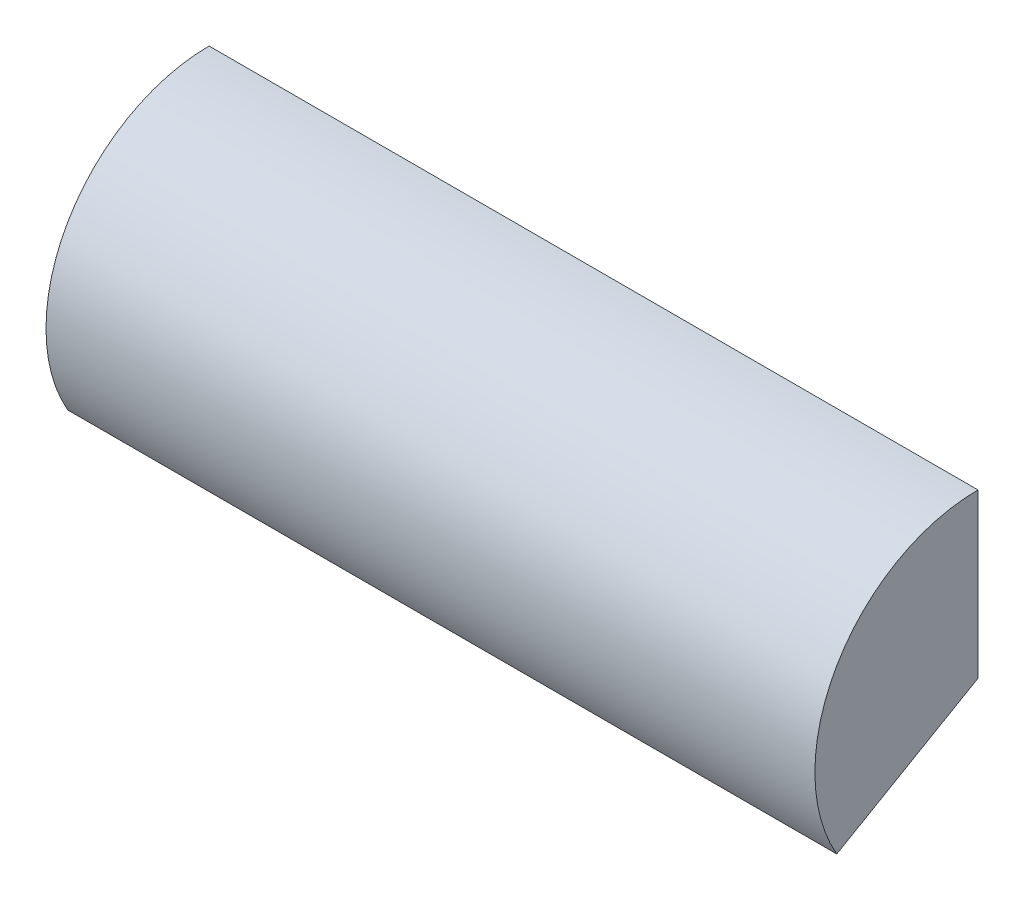
from build123d import *

# Parameters (mm, degrees)
SKETCH1_W          = 44.45
SKETCH1_H          = 215.9
REVOLVE1_ANGLE     = 120
CUT_EXTRUDE1_DEPTH = 3.175
CUT_EXTRUDE2_START = -3.175
CUT_EXTRUDE2_DEPTH = 3.175


with BuildPart() as part:
    # Sketch1 → Revolve1 (revolve)
    with BuildSketch(Plane(origin=(0, 0, 0), x_dir=(0, 1, 0), z_dir=(0, 0, 1))):
        with Locations((22.225, 107.95)):
            Rectangle(SKETCH1_W, SKETCH1_H)
    revolve(axis=Axis((0, 0, 0), (1, 0, 0)), revolution_arc=REVOLVE1_ANGLE)

    # Sketch21 → Cut-Revolve21 (revolve, cut)
    with BuildSketch(Plane(origin=(0, 0, 0), x_dir=(-1, 0, 0), z_dir=(0, 0, -1))):
        with BuildLine():
            Line((3.81, 0), (193.361475911, 0))
            Line((193.361475911, 0), (193.361555592, 1.489862296))
            Line((193.361555592, 1.489862296), (73.362678959, 22.496280175))
            Line((73.362678959, 22.496280175), (71.862679183, 22.500563741))
            Line((71.862679183, 22.500563741), (63.809813581, 22.500497032))
            add(Edge.make_bspline(
                [(3.81, 0), (3.409136339, 11.429131598), (63.809813581, 22.500497032)],
                knots=[0, 0, 0, 1, 1, 1], degree=2))
        make_face()
    revolve(axis=Axis((-215.9, 0, 0), (1, 0, 0)), mode=Mode.SUBTRACT)

    # Sketch22 → Cut-Extrude1 (cut)
    with BuildSketch(Plane(origin=(-215.9, 0, 0), x_dir=(0, -1, 0), z_dir=(-1, 0, 0))):
        with BuildLine():
            Line((-44.45, 0), (0, 0))
            Line((0, 0), (22.225, 38.494829198))
            ThreePointArc((22.225, 38.494829198), (-22.225, 38.494829198), (-44.45, 0))
        make_face()
    extrude(amount=-CUT_EXTRUDE1_DEPTH, mode=Mode.SUBTRACT)

    # Sketch23 → Cut-Extrude2 (cut)
    with BuildSketch(Plane.YZ.offset(CUT_EXTRUDE2_START)):
        with BuildLine():
            Line((-22.225, 38.494829198), (0, 0))
            Line((0, 0), (44.45, 0))
            ThreePointArc((44.45, 0), (22.225, 38.494829198), (-22.225, 38.494829198))
        make_face()
    extrude(amount=CUT_EXTRUDE2_DEPTH, mode=Mode.SUBTRACT)


solid = part.part
